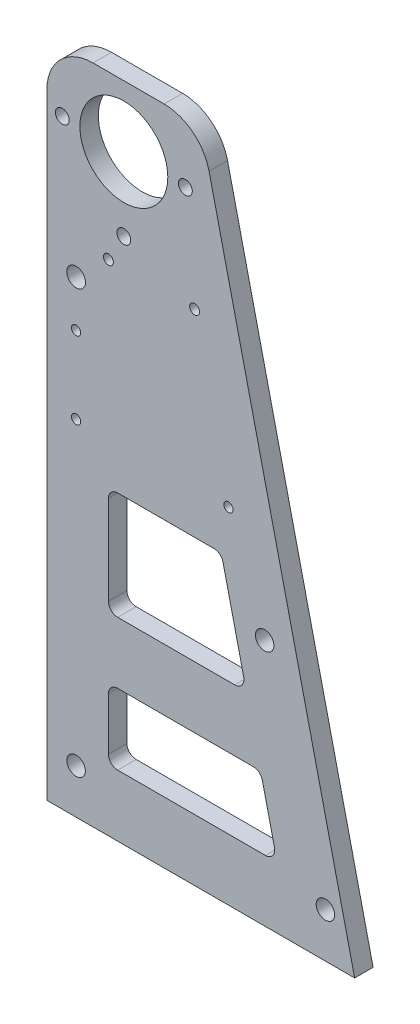
from build123d import *

# Parameters (mm, degrees)
ESBO_O1_R                = 14.2875
ESBO_O1_R_2              = 3
RESSALTO_EXTRUS_O2_DEPTH = 6
FILETE1_R                = 15
ESBO_O3_R                = 1.5
ESBO_O3_R_2              = 3
ESBO_O3_R_3              = 3.05
CORTE_EXTRUS_O1_DEPTH    = 238.194013415
ESBO_O5_R                = 2.25
ESBO_O5_R_2              = 3
ESBO_O5_R_3              = 1.6
CORTE_EXTRUS_O2_DEPTH    = 238.194013415


with BuildPart() as part:
    # Esboço1 → Ressalto-extrusão2 (new body)
    with BuildSketch(Plane.XY):
        Polygon((0, 0), (0, 215), (50, 215), (100, 0), align=None)
        with Locations((25, 195)):
            Circle(ESBO_O1_R, mode=Mode.SUBTRACT)
        with Locations((9.5, 14.5)):
            Circle(ESBO_O1_R_2, mode=Mode.SUBTRACT)
        with BuildLine():
            Line((20, 95), (20, 66))
            ThreePointArc((20, 66), (20.878679656, 63.878679656), (23, 63))
            Line((23, 63), (61.03739436, 63))
            ThreePointArc((61.03739436, 63), (63.386715693, 64.134339454), (63.959418441, 66.679540484))
            Line((63.959418441, 66.679540484), (57.215232395, 95.679540484))
            ThreePointArc((57.215232395, 95.679540484), (56.15886886, 97.349321333), (54.293208314, 98))
            Line((54.293208314, 98), (23, 98))
            ThreePointArc((23, 98), (20.878679656, 97.121320344), (20, 95))
        make_face(mode=Mode.SUBTRACT)
        with BuildLine():
            Line((20, 40), (20, 23))
            ThreePointArc((20, 23), (20.878679656, 20.878679656), (23, 20))
            Line((23, 20), (71.03739436, 20))
            ThreePointArc((71.03739436, 20), (73.386715693, 21.134339454), (73.959418441, 23.679540484))
            Line((73.959418441, 23.679540484), (70.005930069, 40.679540484))
            ThreePointArc((70.005930069, 40.679540484), (68.949566534, 42.349321333), (67.083905988, 43))
            Line((67.083905988, 43), (23, 43))
            ThreePointArc((23, 43), (20.878679656, 42.121320344), (20, 40))
        make_face(mode=Mode.SUBTRACT)
    extrude(amount=RESSALTO_EXTRUS_O2_DEPTH)

    # Filete1
    filete1_edges = [part.edges().sort_by_distance(p)[0] for p in [
        (0, 215, 3),
        (50, 215, 3),
    ]]
    fillet(filete1_edges, radius=FILETE1_R)

    # Esboço3 → Corte-extrusão1 (cut, through all)
    with BuildSketch(Plane(origin=(0, 0, 0), x_dir=(-1, 0, 0), z_dir=(0, 0, -1))):
        with Locations((-9.5, 112)):
            Circle(ESBO_O3_R)
        with Locations((-90.5, 14.5)):
            Circle(ESBO_O3_R_2)
        with Locations((-9.5, 137)):
            Circle(ESBO_O3_R)
        with Locations((-9.5, 152)):
            Circle(ESBO_O3_R_3)
        with Locations((-59, 112)):
            Circle(ESBO_O3_R)
    extrude(amount=-CORTE_EXTRUS_O1_DEPTH, mode=Mode.SUBTRACT)

    # Esboço5 → Corte-extrusão2 (cut, through all)
    with BuildSketch(Plane(origin=(0, 0, 0), x_dir=(-1, 0, 0), z_dir=(0, 0, -1))):
        with Locations((-25, 171.1875)):
            Circle(ESBO_O5_R)
        with Locations((-70.759810426, 80.398555206)):
            Circle(ESBO_O5_R_2)
        with Locations((-20, 162.1875)):
            Circle(ESBO_O5_R_3)
        with Locations((-48, 162.1875)):
            Circle(ESBO_O5_R_3)
        with Locations((-45, 195)):
            Circle(ESBO_O5_R)
        with Locations((-5, 195)):
            Circle(ESBO_O5_R)
    extrude(amount=-CORTE_EXTRUS_O2_DEPTH, mode=Mode.SUBTRACT)


solid = part.part
